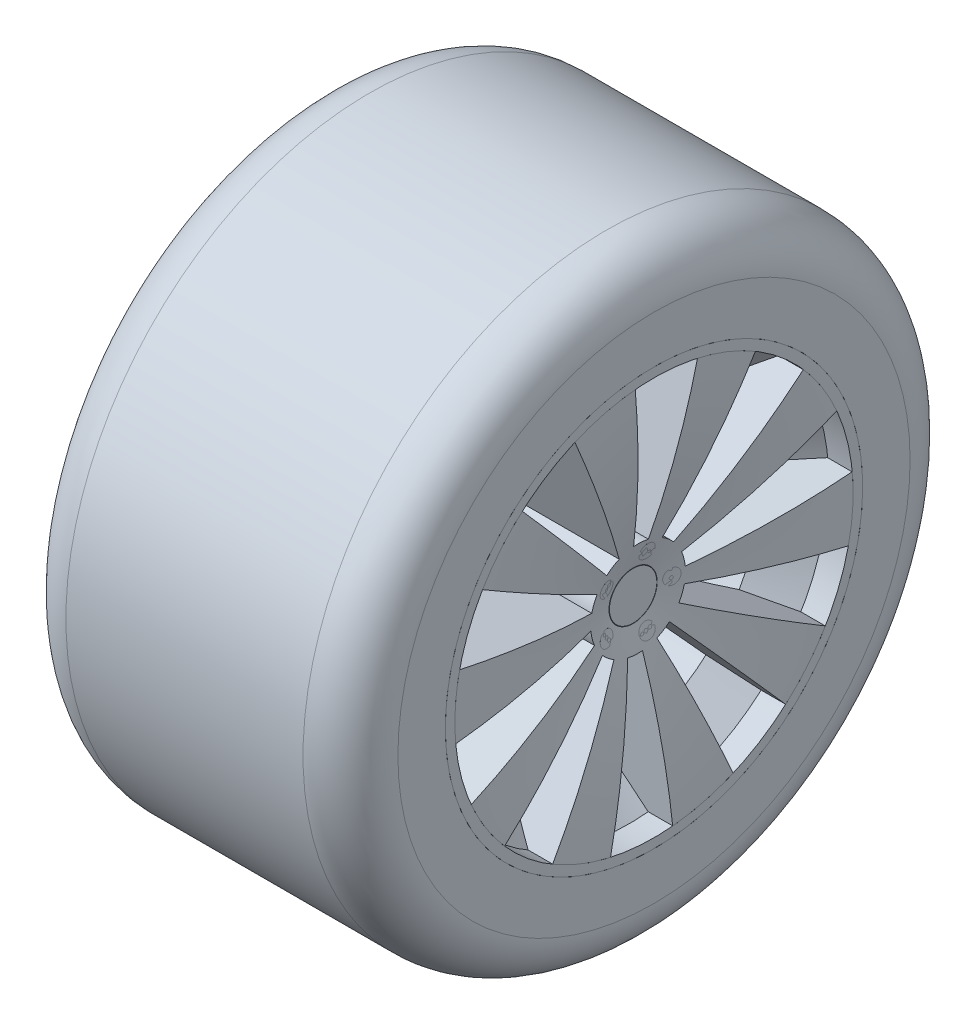
from build123d import *

# Parameters (mm, degrees)
SKETCH3_R           = 50
BOSS_EXTRUDE2_DEPTH = 230.00000000000003
SKETCH4_R           = 25
BOSS_EXTRUDE3_DEPTH = 420.00000000000006
CIRPATTERN5_COUNT   = 5
CUT_EXTRUDE5_DEPTH  = 712.6178749862893
CIRPATTERN7_COUNT   = 10
SKETCH8_R           = 320
SKETCH8_R_2         = 220.00000000000028
BOSS_EXTRUDE6_DEPTH = 350
FILLET1_R           = 50
CUT_EXTRUDE6_ANGLE  = 24.222495
SKETCH12_R          = 25.423866015736184
CUT_EXTRUDE11_DEPTH = 312


# Read off the part's stored shape, not the designer's step: Cut-Extrude6, Cut-Extrude7
with BuildPart() as part:
    # Sketch2 → Revolve2 (revolve)
    with BuildSketch(Plane(origin=(0, 0, 0), x_dir=(1, 0, 0), z_dir=(0, 1, 0)), mode=Mode.PRIVATE) as revolve2_sk:
        Polygon((0, 220.00000000000227), (30.000000000000053, 220.00000000000227), (65.000000000001, 185.0000000000013), (285.000000000001, 185.00000000000128), (320, 220.00000000000028), (350, 220.00000000000028), (350, 210.00000000000026), (324.1421356237309, 210.00000000000026), (289.1421356237319, 175.0000000000013), (60.85786437627006, 175.0000000000013), (25.85786437626906, 210.00000000000227), (0, 210.00000000000227), align=None)
    revolve(revolve2_sk.sketch.rotate(Axis((0, 0, 0), (1, 0, 0)), 180), axis=Axis((0, 0, 0), (1, 0, 0)))


with BuildPart() as body_2:
    # Sketch3 → Boss-Extrude2 (new body)
    with BuildSketch(Plane(origin=(220, 0, 0), x_dir=(0, 0, -1), z_dir=(1, 0, 0))):
        Circle(SKETCH3_R)
    extrude(amount=-BOSS_EXTRUDE2_DEPTH)

    # Sketch5 → Revolve3 (revolve)
    with BuildSketch(Plane(origin=(0, 0, 0), x_dir=(1, 0, 0), z_dir=(0, 1, 0)), mode=Mode.PRIVATE) as revolve3_sk:
        Polygon((220, 41.13364433282925), (310, 41.13364433282925), (315.3675491184545, 46.13163336946515), (363.36754911845446, 46.13163336946515), (363.36754911845446, 38.13163336946515), (220, 38.13163336946515), align=None)
    revolve3 = revolve(revolve3_sk.sketch.rotate(Axis((220, 0, -38.13163336946515), (1, 0, 0)), 180), axis=Axis((220, 0, -38.13163336946515), (1, 0, 0)))

    # CirPattern5: Revolve3 ×5 about axis
    cirpattern5_axis = Axis((0, -4.4e-16, -9e-17), (1, 0, 0))
    for i in range(1, CIRPATTERN5_COUNT):
        add(revolve3.rotate(cirpattern5_axis, i * 360 / CIRPATTERN5_COUNT))

    # Cut-Extrude6 outline → Cut-Extrude6 (revolve, cut)
    with BuildSketch(Plane(origin=(0, 0, 0), x_dir=(0, -0.994723140487943, -0.10259568108748085), z_dir=(0, -0.10259568108748085, 0.994723140487943))):
        with BuildLine():
            Line((30.131633369, 363.367549118), (30.131633222, 329.016159222))
            add(Edge.make_bspline(
                [(30.131633222, 329.016159222), (38.12670146938151, 330.79231346245), (46.131633369, 332.4186243)],
                knots=[0.02568163048487177, 0.02568163048487177, 0.02568163048487177, 0.11289456288363356, 0.11289456288363356, 0.11289456288363356], degree=2))
            Line((46.131633369, 332.4186243), (46.131633369, 363.367549118))
            Line((46.131633369, 363.367549118), (30.131633369, 363.367549118))
        make_face()
    revolve(axis=Axis((0, 0, 0), (1, 0, 0)), revolution_arc=CUT_EXTRUDE6_ANGLE, mode=Mode.SUBTRACT)

    # Cut-Extrude7 outline → Cut-Extrude7 (revolve, cut)
    with BuildSketch(Plane.YX):
        with BuildLine():
            Line((0, 329.016159064), (30.131633098, 329.016159195))
            add(Edge.make_bspline(
                [(30.131633098, 329.016159195), (38.12683739406694, 330.7923436620358), (46.131905678, 332.418679623)],
                knots=[0.02568162980749342, 0.02568162980749342, 0.02568162980749342, 0.11289604627532766, 0.11289604627532766, 0.11289604627532766], degree=2))
            Line((46.131905678, 332.418679623), (46.13200571, 363.367549118))
            Line((46.13200571, 363.367549118), (0, 363.367549118))
            Line((0, 363.367549118), (0, 329.016159064))
        make_face()
    revolve(axis=Axis((0, 0, 0), (1, 0, 0)), mode=Mode.SUBTRACT)


with BuildPart() as body_3:
    # Sketch4 → Boss-Extrude3 (new body)
    with BuildSketch(Plane(origin=(220, 0, 0), x_dir=(0, 0, -1), z_dir=(1, 0, 0))):
        Circle(SKETCH4_R)
    extrude(amount=BOSS_EXTRUDE3_DEPTH)

    # Sketch12 → Cut-Extrude11 (cut)
    with BuildSketch(Plane(origin=(640, 0, 0), x_dir=(0, 0, -1), z_dir=(1, 0, 0))):
        with Locations(Location((0, 0, 0), (0, 0, 180))):
            Circle(SKETCH12_R)
    extrude(amount=-CUT_EXTRUDE11_DEPTH, mode=Mode.SUBTRACT)


with BuildPart() as body_4:
    # Sketch6 → Revolve5 (revolve)
    with BuildSketch(Plane(origin=(0, 0, 0), x_dir=(1, 0, 0), z_dir=(0, 1, 0)), mode=Mode.PRIVATE) as revolve5_sk:
        with BuildLine():
            Line((220, 50), (220, 25.42386601573618))
            Line((220, 25.42386601573618), (327.957116037774, 25.42386601573618))
            add(Edge.make_bspline(
                [(327.957116037774, 25.42386601573618), (348.8287762699382, 117.06352853986013), (350, 210.00000000000026)],
                knots=[0, 0, 0, 1, 1, 1], degree=2))
            Line((350, 210.00000000000026), (324.1421356237309, 210.00000000000034))
            Line((324.1421356237309, 210.00000000000034), (289.1421356237319, 175.0000000000013))
            add(Edge.make_bspline(
                [(289.1421356237319, 175.0000000000013), (271.19382720649685, 87.98918199562422), (251.1749506390153, 85.99187715845753), (220, 50)],
                knots=[0, 0, 0, 0, 1, 1, 1, 1], degree=3))
        make_face()
    revolve(revolve5_sk.sketch.rotate(Axis((0, 0, 0), (1, 0, 0)), 180), axis=Axis((0, 0, 0), (1, 0, 0)))

    # Sketch7 → Cut-Extrude5 (cut, through all)
    with BuildSketch(Plane(origin=(0, 0, 0), x_dir=(0, 0, -1), z_dir=(1, 0, 0))):
        with BuildLine():
            Line((25.45839239073909, 43.03336213775493), (106.92524804110428, 180.7401209785709))
            ThreePointArc((106.92524804110428, 180.7401209785709), (133.882804942032, 161.7881161916859), (157.54372285373026, 138.85235104018633))
            Line((157.54372285373026, 138.85235104018633), (37.510410203269075, 33.06008358099672))
            ThreePointArc((37.510410203269075, 33.06008358099672), (31.876858319531202, 38.52098004563923), (25.45839239073909, 43.03336213775493))
        make_face()
    cut_extrude5 = extrude(amount=CUT_EXTRUDE5_DEPTH, mode=Mode.SUBTRACT)

    # CirPattern7: Cut-Extrude5 ×10 about axis
    cirpattern7_axis = Axis((0, 1.4e-16, -7e-16), (1, 0, 0))
    for i in range(1, CIRPATTERN7_COUNT):
        add(cut_extrude5.rotate(cirpattern7_axis, i * 360 / CIRPATTERN7_COUNT), mode=Mode.SUBTRACT)


with BuildPart() as body_5:
    # Sketch8 → Boss-Extrude6 (new body)
    with BuildSketch(Plane(origin=(350, 0, 0), x_dir=(0, 0, -1), z_dir=(1, 0, 0))):
        Circle(SKETCH8_R)
        Circle(SKETCH8_R_2, mode=Mode.SUBTRACT)
    extrude(amount=-BOSS_EXTRUDE6_DEPTH)

    # Fillet1
    fillet1_edges = [body_5.edges().sort_by_distance(p)[0] for p in [
        (350, 3.919e-14, 320),
        (0, 3.919e-14, 320),
    ]]
    fillet(fillet1_edges, radius=FILLET1_R)


solid = Compound([part.part, body_2.part, body_3.part, body_4.part, body_5.part])
